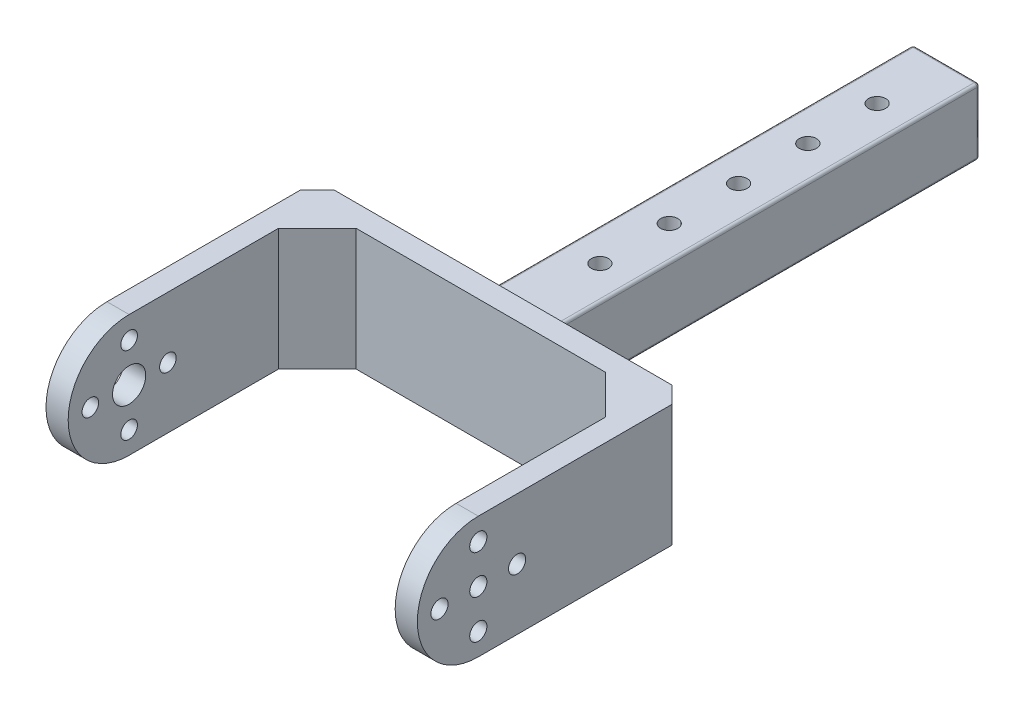
from build123d import *

# Parameters (mm, degrees)
BOSS_EXTRUDE1_DEPTH      = 22
SKETCH3_R                = 1.55
CUT_EXTRUDE1_DEPTH       = 30
CUT_EXTRUDE5_DEPTH       = 9
SKETCH11_R               = 1.55
CUT_EXTRUDE10_DEPTH      = 13
CUT_EXTRUDE11_START      = -10
CUT_EXTRUDE11_DEPTH      = 10
SKETCH13_R               = 3
SKETCH13_R_2             = 1.5
CUT_EXTRUDE12_DEPTH      = 4
SKETCH14_W               = 54
SKETCH14_H               = 9.3
SKETCH14_W_2             = 7.05
SKETCH14_H_2             = 4
BOSS_EXTRUDE4_DEPTH      = 4
SKETCH17_W               = 7.05
SKETCH17_H               = 4
BOSS_EXTRUDE5_DEPTH      = 23.05
BOSS_EXTRUDE6_DEPTH      = 27.3
BOSS_EXTRUDE6_DEPTH_BACK = 4
SKETCH18_W               = 54
SKETCH18_H               = 2.95
SKETCH19_W               = 54
SKETCH19_H               = 2.8
BOSS_EXTRUDE7_DEPTH      = 21
FILLET2_SIZE             = 6.5
FILLET3_SIZE             = 0.5
SKETCH20_R               = 3.970030919
BOSS_EXTRUDE8_DEPTH      = 6
FILLET4_R                = 1
CUT_EXTRUDE13_START      = -37.3
CUT_EXTRUDE13_DEPTH      = 37.3
SKETCH22_W               = 56.118071471
SKETCH22_H               = 11.813110758
CUT_EXTRUDE14_DEPTH      = 56
SKETCH23_W               = 67
SKETCH23_H               = 4
BOSS_EXTRUDE9_DEPTH      = 4
SKETCH24_W               = 67
SKETCH24_H               = 4
BOSS_EXTRUDE10_DEPTH     = 4
SKETCH25_W               = 12
SKETCH25_H               = 12
BOSS_EXTRUDE11_DEPTH     = 80
FILLET6_SIZE             = 7
SKETCH27_W               = 67
SKETCH27_H               = 4
CUT_EXTRUDE16_DEPTH      = 80
FILLET7_SIZE             = 5
SKETCH29_R               = 1.55
CUT_EXTRUDE17_DEPTH      = 12
FILLET8_R                = 0.5
FILLET9_R                = 0.5
FILLET10_SIZE            = 3


# Read off the part's stored shape, not the designer's step: Cut-Extrude13
with BuildPart() as part:
    # Sketch1 → Boss-Extrude1 (new body)
    with BuildSketch(Plane(origin=(0, 0, 0), x_dir=(1, 0, 0), z_dir=(0, 1, 0))):
        Polygon((0, 0), (0, 50), (67, 50), (67, 0), (63, 0), (63, 46), (4, 46), (4, 0), align=None)
    extrude(amount=BOSS_EXTRUDE1_DEPTH)

    # Sketch3 → Cut-Extrude1 (cut)
    with BuildSketch(Plane(origin=(67, 0, 0), x_dir=(0, 0, -1), z_dir=(1, 0, 0))):
        with Locations((12.05, 11)):
            Circle(SKETCH3_R)
    extrude(amount=-CUT_EXTRUDE1_DEPTH, mode=Mode.SUBTRACT)

    # Sketch5 → Cut-Extrude5 (cut)
    with BuildSketch(Plane(origin=(67, 0, 0), x_dir=(0, 0, -1), z_dir=(1, 0, 0))):
        with BuildLine():
            Line((12.05, 22), (0, 22))
            Line((0, 22), (0, 0))
            Line((0, 0), (12.05, 0))
            ThreePointArc((12.05, 0), (1.05, 11), (12.05, 22))
        make_face()
    extrude(amount=-CUT_EXTRUDE5_DEPTH, mode=Mode.SUBTRACT)

    # Sketch11 → Cut-Extrude10 (cut)
    with BuildSketch(Plane(origin=(67, 0, 0), x_dir=(0, 0, -1), z_dir=(1, 0, 0))):
        with Locations((19.05, 11)):
            Circle(SKETCH11_R)
        with Locations((12.05, 18)):
            Circle(SKETCH11_R)
        with Locations((12.05, 4)):
            Circle(SKETCH11_R)
        with Locations((5.05, 11)):
            Circle(SKETCH11_R)
    extrude(amount=-CUT_EXTRUDE10_DEPTH, mode=Mode.SUBTRACT)

    # Sketch12 → Cut-Extrude11 (cut)
    with BuildSketch(Plane.ZY.offset(CUT_EXTRUDE11_START)):
        with BuildLine():
            Line((-12.05, 22), (0, 22))
            Line((0, 22), (0, 0))
            Line((0, 0), (-12.05, 0))
            ThreePointArc((-12.05, 0), (-1.05, 11), (-12.05, 22))
        make_face()
    extrude(amount=CUT_EXTRUDE11_DEPTH, mode=Mode.SUBTRACT)

    # Sketch13 → Cut-Extrude12 (cut)
    with BuildSketch(Plane.ZY):
        with Locations((-12.05, 11)):
            Circle(SKETCH13_R)
        with Locations((-19.05, 11)):
            Circle(SKETCH13_R_2)
        with Locations((-12.05, 4)):
            Circle(SKETCH13_R_2)
        with Locations((-5.05, 11)):
            Circle(SKETCH13_R_2)
        with Locations((-12.05, 18)):
            Circle(SKETCH13_R_2)
    extrude(amount=-CUT_EXTRUDE12_DEPTH, mode=Mode.SUBTRACT)

    # Sketch14 → Boss-Extrude4 (add)
    with BuildSketch(Plane(origin=(0, 0, -50), x_dir=(-1, 0, 0), z_dir=(0, 0, -1))):
        with Locations((-33.5, -4.65)):
            Rectangle(SKETCH14_W, SKETCH14_H)
        with Locations((-56.975, 20)):
            Rectangle(SKETCH14_W_2, SKETCH14_H_2)
        with Locations((-10.025, 20)):
            Rectangle(SKETCH14_W_2, SKETCH14_H_2)
    extrude(amount=-BOSS_EXTRUDE4_DEPTH)

    # Sketch17 → Boss-Extrude5 (add)
    with BuildSketch(Plane(origin=(0, 0, -50), x_dir=(-1, 0, 0), z_dir=(0, 0, -1))):
        with Locations((-56.975, 20)):
            Rectangle(SKETCH17_W, SKETCH17_H)
        with Locations((-10.025, 20)):
            Rectangle(SKETCH17_W, SKETCH17_H)
    extrude(amount=BOSS_EXTRUDE5_DEPTH)

    # Sketch18 → Boss-Extrude6 (add, two sides: drawn at the far end of the back side and taken through both)
    with BuildSketch(Plane.XZ.offset(-18).offset(-BOSS_EXTRUDE6_DEPTH_BACK)):
        with Locations((33.5, -71.575)):
            Rectangle(SKETCH18_W, SKETCH18_H)
    extrude(amount=BOSS_EXTRUDE6_DEPTH + BOSS_EXTRUDE6_DEPTH_BACK)

    # Sketch19 → Boss-Extrude7 (add)
    with BuildSketch(Plane(origin=(0, 0, -50), x_dir=(-1, 0, 0), z_dir=(0, 0, -1))):
        with Locations((-33.5, -7.9)):
            Rectangle(SKETCH19_W, SKETCH19_H)
    extrude(amount=BOSS_EXTRUDE7_DEPTH)

    # Fillet2
    fillet2_edges = [part.edges().sort_by_distance(p)[0] for p in [
        (60.5, 20, -50),
        (6.5, 20, -50),
    ]]
    chamfer(fillet2_edges, length=FILLET2_SIZE - 0.0001)  # a hair under: the kernel refuses the full size

    # Fillet3
    fillet3_edges = [part.edges().sort_by_distance(p)[0] for p in [
        (60.5, 6.35, -73.05),
        (6.5, 6.35, -73.05),
    ]]
    chamfer(fillet3_edges, length=FILLET3_SIZE)

    # Sketch20 → Boss-Extrude8 (add)
    with BuildSketch(Plane.XZ.offset(9.3)):
        with Locations(Location((23.4, -59.65, 0), (0, 0, 270))):
            Circle(SKETCH20_R)
    extrude(amount=BOSS_EXTRUDE8_DEPTH)

    # Fillet4
    fillet4_edges = [part.edges().sort_by_distance(p)[0] for p in [
        (23.4, -15.3, -55.679969081),
    ]]
    fillet(fillet4_edges, radius=FILLET4_R)

    # Cut-Extrude13 outline → Cut-Extrude13 (cut)
    with BuildSketch(Plane(origin=(0, 22, 0), x_dir=(1, 0, 0), z_dir=(0, 1, 0)).offset(CUT_EXTRUDE13_START)):
        Polygon((67, 50), (60.5, 56.5), (60.5, 72.55), (60, 73.05), (7, 73.05), (6.5, 72.55), (6.5, 56.5), (0, 50), align=None)
    extrude(amount=CUT_EXTRUDE13_DEPTH, mode=Mode.SUBTRACT)

    # Sketch22 → Cut-Extrude14 (cut)
    with BuildSketch(Plane(origin=(0, 0, -50), x_dir=(-1, 0, 0), z_dir=(0, 0, -1))):
        with Locations((-32.440964265, -5.906555379)):
            Rectangle(SKETCH22_W, SKETCH22_H)
    extrude(amount=-CUT_EXTRUDE14_DEPTH, mode=Mode.SUBTRACT)

    # Sketch23 → Boss-Extrude9 (add)
    with BuildSketch(Plane(origin=(0, 22, 0), x_dir=(1, 0, 0), z_dir=(0, 1, 0))):
        with Locations((33.5, 48)):
            Rectangle(SKETCH23_W, SKETCH23_H)
    extrude(amount=BOSS_EXTRUDE9_DEPTH)

    # Sketch24 → Boss-Extrude10 (add)
    with BuildSketch(Plane.XZ):
        with Locations((33.5, -48)):
            Rectangle(SKETCH24_W, SKETCH24_H)
    extrude(amount=BOSS_EXTRUDE10_DEPTH)

    # Sketch25 → Boss-Extrude11 (add)
    with BuildSketch(Plane(origin=(0, 0, -50), x_dir=(-1, 0, 0), z_dir=(0, 0, -1))):
        with Locations((-33.5, 11)):
            Rectangle(SKETCH25_W, SKETCH25_H)
    extrude(amount=BOSS_EXTRUDE11_DEPTH)

    # Fillet6
    fillet6_edges = [part.edges().sort_by_distance(p)[0] for p in [
        (63, 11, -46),
        (4, 11, -46),
    ]]
    chamfer(fillet6_edges, length=FILLET6_SIZE)

    # Sketch27 → Cut-Extrude16 (cut)
    with BuildSketch(Plane.XY.offset(-46)):
        with Locations((33.5, 24)):
            Rectangle(SKETCH27_W, SKETCH27_H)
        with Locations((33.5, -2)):
            Rectangle(SKETCH27_W, SKETCH27_H)
    extrude(amount=-CUT_EXTRUDE16_DEPTH, mode=Mode.SUBTRACT)

    # Fillet7
    fillet7_edges = [part.edges().sort_by_distance(p)[0] for p in [
        (39.5, 11, -50),
        (33.5, 5, -50),
        (27.5, 11, -50),
        (33.5, 17, -50),
    ]]
    chamfer(fillet7_edges, length=FILLET7_SIZE - 0.0001)  # a hair under: the kernel refuses the full size

    # Sketch29 → Cut-Extrude17 (cut)
    with BuildSketch(Plane.XZ.offset(-5)):
        with Locations(Location((33.5, -67.5, 0), (0, 0, 270))):
            Circle(SKETCH29_R)
        with Locations(Location((33.5, -80, 0), (0, 0, 270))):
            Circle(SKETCH29_R)
        with Locations(Location((33.5, -92.5, 0), (0, 0, 270))):
            Circle(SKETCH29_R)
        with Locations(Location((33.5, -105, 0), (0, 0, 270))):
            Circle(SKETCH29_R)
        with Locations(Location((33.5, -117.5, 0), (0, 0, 270))):
            Circle(SKETCH29_R)
    extrude(amount=-CUT_EXTRUDE17_DEPTH, mode=Mode.SUBTRACT)

    # Fillet8
    fillet8_edges = [part.edges().sort_by_distance(p)[0] for p in [
        (39.5, 17, -92.49995),
        (39.5, 5, -92.49995),
        (27.5, 5, -92.49995),
        (27.5, 17, -92.49995),
        (39.5, 11, -130),
        (33.5, 5, -130),
        (27.5, 11, -130),
        (33.5, 17, -130),
    ]]
    fillet(fillet8_edges, radius=FILLET8_R)

    # Fillet9
    fillet9_edges = [part.edges().sort_by_distance(p)[0] for p in [
        (41.926726695, 19.426726695, -52.573173305),
        (41.926726695, 2.573273305, -52.573173305),
        (25.073273305, 19.426726695, -52.573173305),
        (25.073273305, 2.573273305, -52.573173305),
    ]]
    fillet(fillet9_edges, radius=FILLET9_R)

    # Fillet10
    fillet10_edges = [part.edges().sort_by_distance(p)[0] for p in [
        (0, 11, -50),
        (67, 11, -50),
    ]]
    chamfer(fillet10_edges, length=FILLET10_SIZE)


solid = part.part
